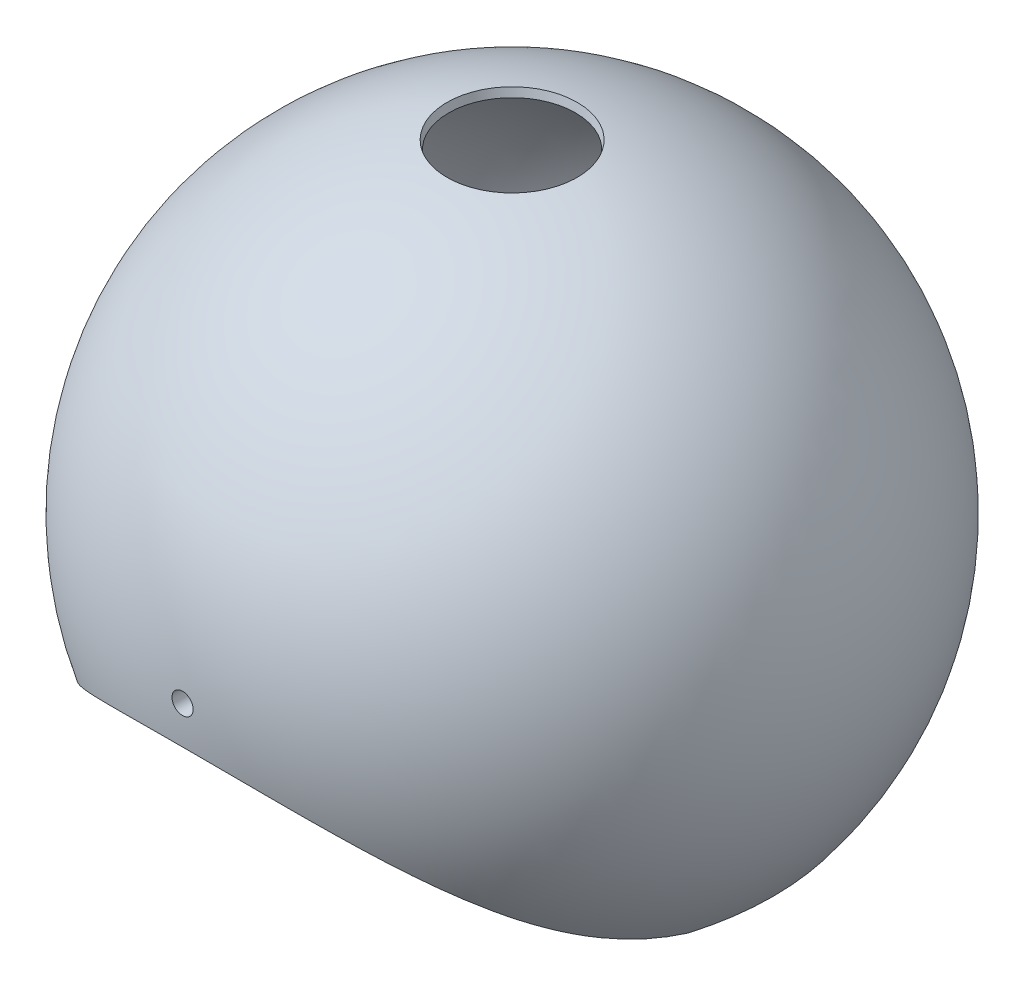
from build123d import *

# Parameters (mm, degrees)
SKETCH2_R                = 5
BOSS_EXTRUDE1_DEPTH      = 10
SKETCH5_R                = 2.45
CUT_EXTRUDE2_DEPTH       = 3
SKETCH6_R                = 2.5
CUT_EXTRUDE3_DEPTH       = 13
SKETCH7_R                = 1
CUT_EXTRUDE4_DEPTH       = 13
CUT_EXTRUDE5_DEPTH       = 190.620679463
CUT_EXTRUDE5_DEPTH_BACK  = 190.620679463
BOSS_EXTRUDE2_DEPTH      = 8
BOSS_EXTRUDE2_DEPTH_BACK = 10
SKETCH10_R               = 1.4
CUT_EXTRUDE6_DEPTH       = 8
BOSS_EXTRUDE3_START      = 6
SKETCH11_R               = 5
BOSS_EXTRUDE3_DEPTH      = 6
SKETCH12_R               = 5
SKETCH12_R_2             = 3
CUT_EXTRUDE8_DEPTH       = 1
SKETCH13_R               = 1.9
CUT_EXTRUDE9_DEPTH       = 5


with BuildPart() as part:
    # Sketch1 → Revolve1 (revolve)
    with BuildSketch(Plane.XY):
        with BuildLine():
            Line((-61.750890187, -47.653200953), (-59.204496779, -47.653200953))
            ThreePointArc((-59.204496779, -47.653200953), (-71.464924193, 25.860483564), (-15, 74.505033387))
            Line((-15, 74.505033387), (-15.394736842, 76.46569216))
            ThreePointArc((-15.394736842, 76.46569216), (-73.070081767, 27.290349038), (-61.750890187, -47.653200953))
        make_face()
    revolve(axis=Axis((0, 0, 0), (0, 1, 0)))

    # Sketch2 → Boss-Extrude1 (add)
    with BuildSketch(Plane.XY.offset(77)):
        Circle(SKETCH2_R)
    extrude(amount=-BOSS_EXTRUDE1_DEPTH)

    # Sketch5 → Cut-Extrude2 (cut)
    with BuildSketch(Plane(origin=(0, 0, 67), x_dir=(-1, 0, 0), z_dir=(0, 0, -1))):
        Circle(SKETCH5_R)
    extrude(amount=-CUT_EXTRUDE2_DEPTH, mode=Mode.SUBTRACT)

    # Sketch6 → Cut-Extrude3 (cut)
    with BuildSketch(Plane(origin=(0, 0, 72), x_dir=(-1, 0, 0), z_dir=(0, 0, -1))):
        Circle(SKETCH6_R)
    extrude(amount=-CUT_EXTRUDE3_DEPTH, mode=Mode.SUBTRACT)

    # Sketch7 → Cut-Extrude4 (cut)
    with BuildSketch(Plane(origin=(0, 0, 70), x_dir=(-1, 0, 0), z_dir=(0, 0, -1))):
        Circle(SKETCH7_R)
    extrude(amount=-CUT_EXTRUDE4_DEPTH, mode=Mode.SUBTRACT)

    # Sketch8 → Cut-Extrude5 (cut, two sides: drawn at the far end of the back side and taken through both)
    with BuildSketch(Plane.XY.offset(77).offset(-CUT_EXTRUDE5_DEPTH_BACK)):
        with BuildLine():
            Line((59.204496779, -47.653200953), (-59.204496779, -47.653200953))
            ThreePointArc((-59.204496779, -47.653200953), (0, -9.482803282), (59.204496779, -47.653200953))
        make_face()
    extrude(amount=CUT_EXTRUDE5_DEPTH + CUT_EXTRUDE5_DEPTH_BACK, mode=Mode.SUBTRACT)

    # Sketch9 → Boss-Extrude2 (add, two sides: drawn at the far end of the back side and taken through both)
    with BuildSketch(Plane(origin=(0, 0, 0), x_dir=(0, 0, -1), z_dir=(1, 0, 0)).offset(-BOSS_EXTRUDE2_DEPTH_BACK)):
        Polygon((-24.799638763, 42.367833372), (-18.503698204, 44.659368332), (-18.503698204, 74.505033387), (-27.09103143, 71.379499701), (-35.489739706, 67.690470627), (-39.978084848, 64.869225109), align=None)
    extrude(amount=BOSS_EXTRUDE2_DEPTH + BOSS_EXTRUDE2_DEPTH_BACK)

    # Sketch10 → Cut-Extrude6 (cut)
    with BuildSketch(Plane(origin=(0, 45.382188608, 16.517765819), x_dir=(1, 0, 0), z_dir=(0, -0.939692620785908, -0.34202014332567005))):
        with Locations((-4.00206731, 5.513385102)):
            Circle(SKETCH10_R)
        with Locations((2.39793269, 5.513385102)):
            Circle(SKETCH10_R)
    extrude(amount=-CUT_EXTRUDE6_DEPTH, mode=Mode.SUBTRACT)

    # Sketch11 → Boss-Extrude3 (add)
    with BuildSketch(Plane.XY.offset(-77).offset(BOSS_EXTRUDE3_START)):
        Circle(SKETCH11_R)
    extrude(amount=-BOSS_EXTRUDE3_DEPTH)

    # Sketch12 → Cut-Extrude8 (cut)
    with BuildSketch(Plane.XY.offset(-71)):
        Circle(SKETCH12_R)
        Circle(SKETCH12_R_2, mode=Mode.SUBTRACT)
    extrude(amount=-CUT_EXTRUDE8_DEPTH, mode=Mode.SUBTRACT)

    # Sketch13 → Cut-Extrude9 (cut)
    with BuildSketch(Plane.XY.offset(-71)):
        Circle(SKETCH13_R)
    extrude(amount=-CUT_EXTRUDE9_DEPTH, mode=Mode.SUBTRACT)


solid = part.part
